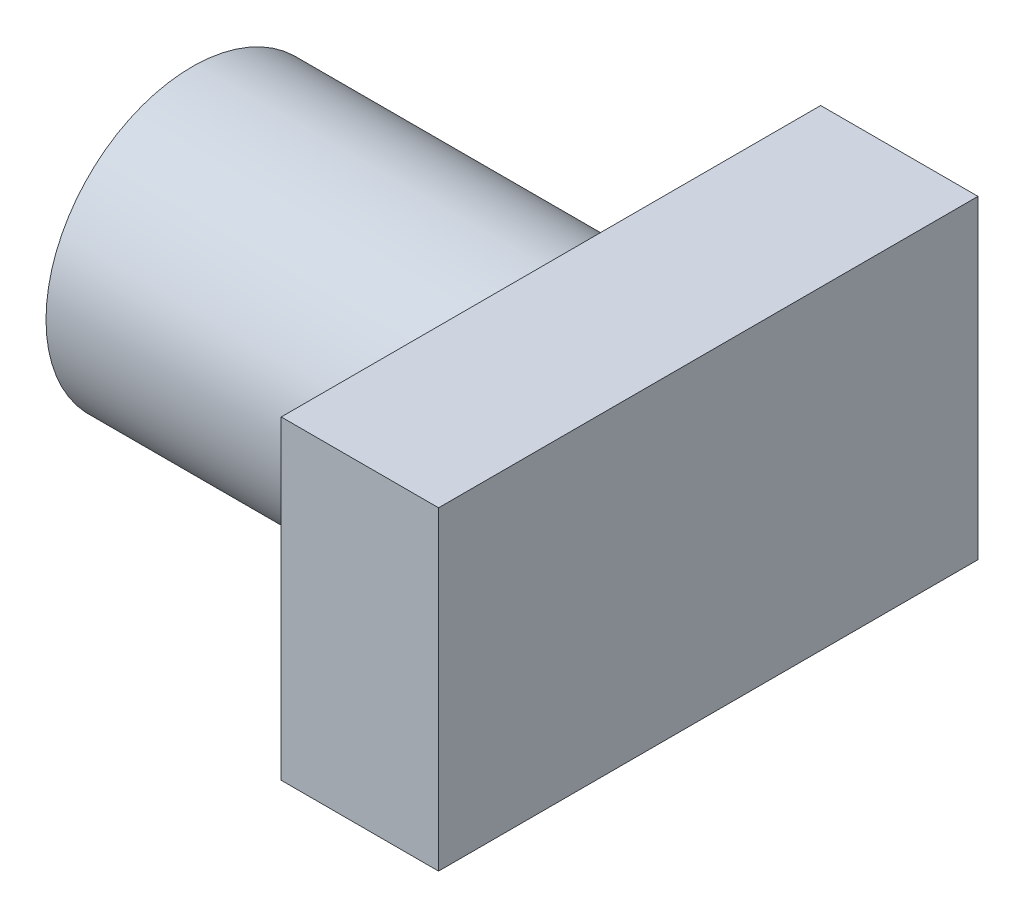
from build123d import *

# Parameters (mm, degrees)
SKETCH1_W           = 35
SKETCH1_H           = 120
BOSS_EXTRUDE1_DEPTH = 70
SKETCH2_R           = 32.5
BOSS_EXTRUDE2_DEPTH = 80


with BuildPart() as part:
    # Sketch1 → Boss-Extrude1 (new body)
    with BuildSketch(Plane(origin=(0, 0, 0), x_dir=(1, 0, 0), z_dir=(0, 1, 0))):
        with Locations((17.5, 60)):
            Rectangle(SKETCH1_W, SKETCH1_H)
    extrude(amount=BOSS_EXTRUDE1_DEPTH)

    # Sketch2 → Boss-Extrude2 (add)
    with BuildSketch(Plane.ZY):
        with Locations((-60.174932569, 34.890792619)):
            Circle(SKETCH2_R)
    extrude(amount=BOSS_EXTRUDE2_DEPTH)


solid = part.part
